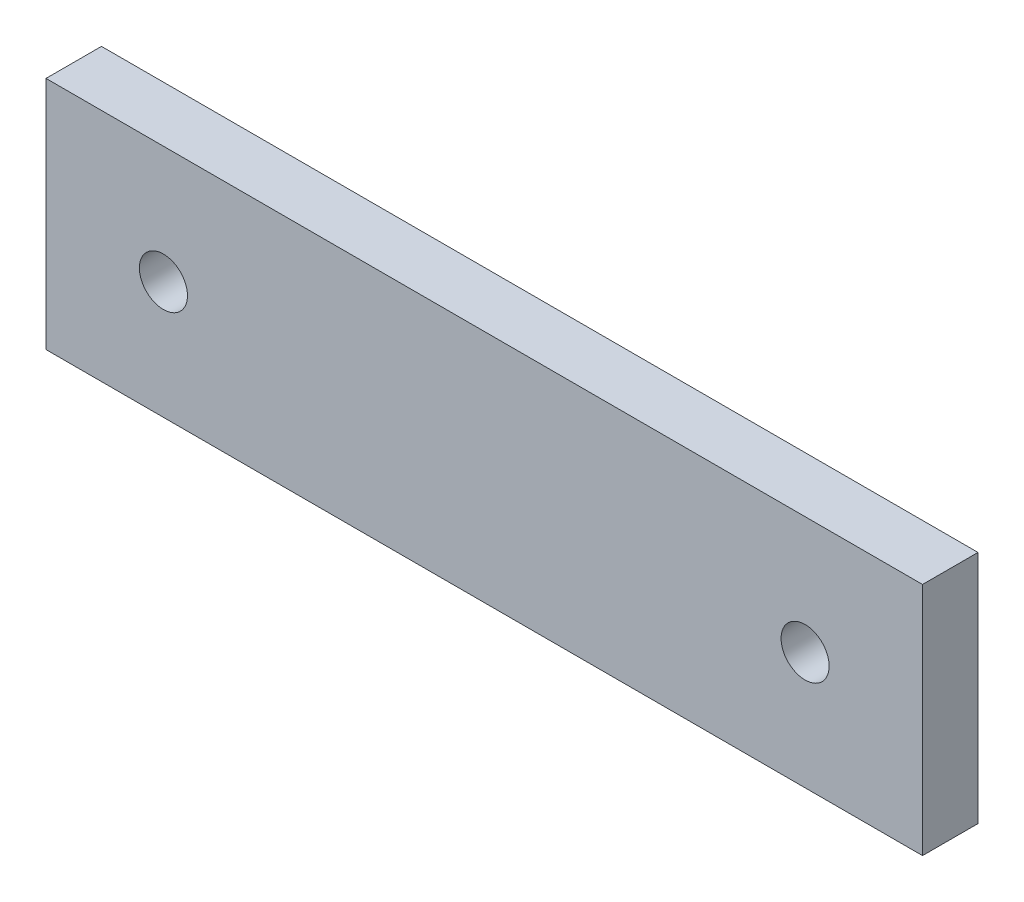
from build123d import *

# Parameters (mm, degrees)
SKETCH1_W           = 94.8
SKETCH1_H           = 25.4
SKETCH1_R           = 2.6
BOSS_EXTRUDE1_DEPTH = 6


with BuildPart() as part:
    # Sketch1 → Boss-Extrude1 (new body)
    with BuildSketch(Plane.XY):
        Rectangle(SKETCH1_W, SKETCH1_H)
        with Locations((34.7, 0)):
            Circle(SKETCH1_R, mode=Mode.SUBTRACT)
        with Locations((-34.7, 0)):
            Circle(SKETCH1_R, mode=Mode.SUBTRACT)
    extrude(amount=BOSS_EXTRUDE1_DEPTH)


solid = part.part
